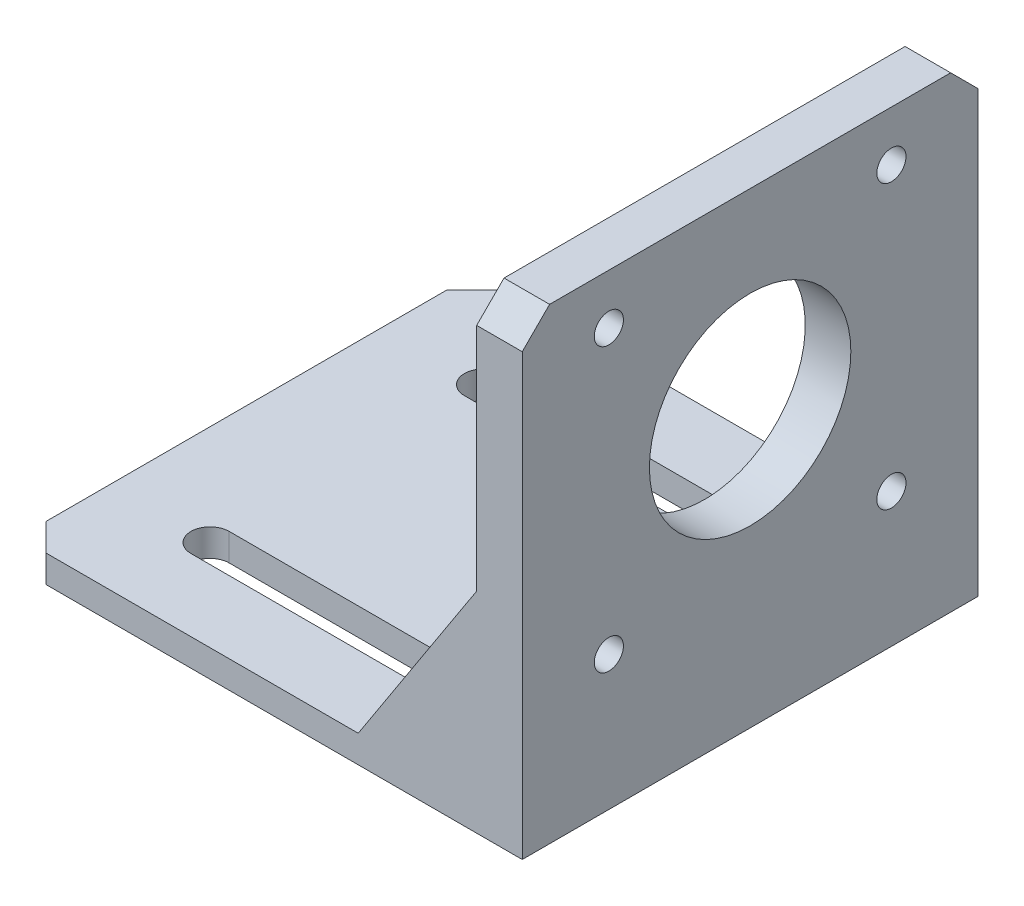
from build123d import *

# Parameters (mm, degrees)
EXTRUDE_1_DEPTH             = 50
HOLE_WIZARD_1_D             = 22.1
HOLE_WIZARD_1_DEPTH         = 100
HOLE_WIZARD_2_D             = 3.2
HOLE_WIZARD_2_DEPTH         = 100
HOLE_START                  = -3
HOLE_WIZARD_4_2_4_2_1_DEPTH = 3
RIB_1_REACH                 = 89.542
SKETCH_13_WALL_W            = 200.93798631
SKETCH_13_WALL_H            = 2.1
CHAMFER_1_SIZE              = 3
EXTRUDE_START               = 2
SKETCH_14_R                 = 1.6
SKETCH_14_R_2               = 11.05
EXTRUDE_2_DEPTH             = 2
CHAMFER_2_SIZE              = 5


# Read off the part's stored shape, not the designer's step: Ø4.2 (4.2) 直径槽口1
with BuildPart() as part:
    # 草图1 → 凸台-拉伸1 (new body)
    with BuildSketch(Plane.XY):
        Polygon((0, 0), (50.25, 0), (50.25, 48.25), (53.25, 48.25), (53.25, -3), (0, -3), align=None)
    extrude(amount=EXTRUDE_1_DEPTH)

    # 孔1
    with Locations(Plane.ZY.offset(-50.25)):
        with Locations((25, 27.25)):
            Hole(HOLE_WIZARD_1_D / 2, depth=HOLE_WIZARD_1_DEPTH)

    # 孔2
    with Locations(Plane.ZY.offset(-50.25)):
        with Locations((9.5, 42.75), (40.5, 42.75), (40.5, 11.75), (9.5, 11.75)):
            Hole(HOLE_WIZARD_2_D / 2, depth=HOLE_WIZARD_2_DEPTH)

    # Ø4.2 (4.2) 直径槽口1 outline → Ø4.2 (4.2) 直径槽口1 (cut)
    with BuildSketch(Plane(origin=(0, 0, 0), x_dir=(1, 0, 0), z_dir=(0, 1, 0)).offset(HOLE_START)):
        with BuildLine():
            Line((11, -42.1), (41, -42.1))
            ThreePointArc((41, -42.1), (43.1, -40), (41, -37.9))
            Line((41, -37.9), (11, -37.9))
            ThreePointArc((11, -37.9), (8.9, -40), (11, -42.1))
        make_face()
        with BuildLine():
            Line((11, -12.1), (41, -12.1))
            ThreePointArc((41, -12.1), (43.1, -10), (41, -7.9))
            Line((41, -7.9), (11, -7.9))
            ThreePointArc((11, -7.9), (8.9, -10), (11, -12.1))
        make_face()
    extrude(amount=HOLE_WIZARD_4_2_4_2_1_DEPTH, mode=Mode.SUBTRACT)

    # 草图13 wall → 筋1 (add, up to next)
    with BuildSketch(Plane(origin=(43.75, 10, 50), x_dir=(-0.544988350595, -0.838443616301, 0), z_dir=(0.838443616301, -0.544988350595, 0)), mode=Mode.PRIVATE) as rib_1_sk1:
        with Locations((0, 1.05)):
            Rectangle(SKETCH_13_WALL_W, SKETCH_13_WALL_H)
    rib_1_tool1 = extrude(rib_1_sk1.sketch, amount=RIB_1_REACH, mode=Mode.PRIVATE) - part.part
    rib_1 = rib_1_tool1.solids().sort_by_distance((43.75, 10, 50))[0]
    add(rib_1)

    # 镜向1: 筋1 across plane
    add(rib_1.mirror(Plane.XY.offset(25)))

    # 倒角1
    chamfer_1_edges = [part.edges().sort_by_distance(p)[0] for p in [
        (51.75, 48.25, 50),
        (0, -1.5, 50),
        (51.75, 48.25, 0),
        (0, -1.5, 0),
    ]]
    chamfer(chamfer_1_edges, length=CHAMFER_1_SIZE)

    # 草图14 → 凸台-拉伸2 (add)
    with BuildSketch(Plane(origin=(53.25, 0, 0), x_dir=(0, 0, -1), z_dir=(1, 0, 0)).offset(EXTRUDE_START)):
        Polygon((-47, 48.25), (-3, 48.25), (0, 45.25), (0, -3), (-50, -3), (-50, 45.25), align=None)
        with Locations(Location((-9.5, 42.75, 0), (0, 0, 180))):
            Circle(SKETCH_14_R, mode=Mode.SUBTRACT)
        with Locations(Location((-40.5, 42.75, 0), (0, 0, 180))):
            Circle(SKETCH_14_R, mode=Mode.SUBTRACT)
        with Locations(Location((-25, 27.25, 0), (0, 0, 180))):
            Circle(SKETCH_14_R_2, mode=Mode.SUBTRACT)
        with Locations(Location((-9.5, 11.75, 0), (0, 0, 180))):
            Circle(SKETCH_14_R, mode=Mode.SUBTRACT)
        with Locations(Location((-40.5, 11.75, 0), (0, 0, 180))):
            Circle(SKETCH_14_R, mode=Mode.SUBTRACT)
    extrude(amount=-EXTRUDE_2_DEPTH)

    # 倒角2
    chamfer_2_edges = [part.edges().sort_by_distance(p)[0] for p in [
        (50.25, 0, 25),
    ]]
    chamfer(chamfer_2_edges, length=CHAMFER_2_SIZE)


solid = part.part
